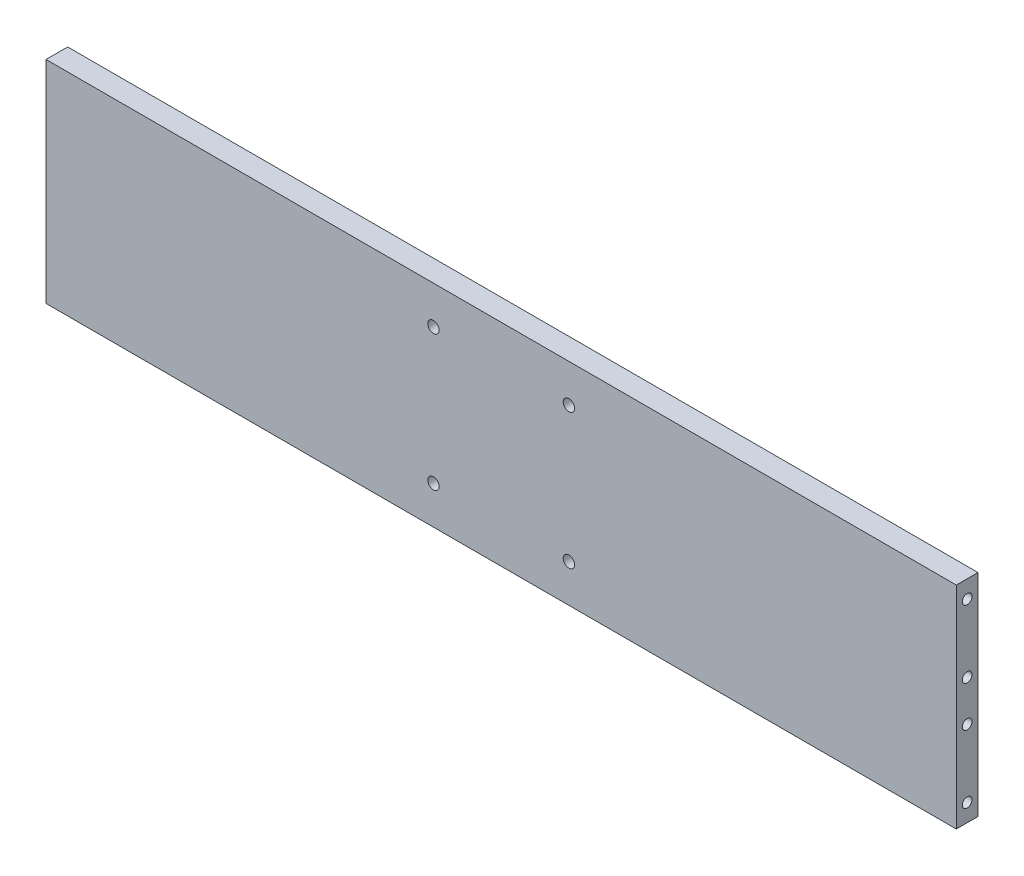
from build123d import *

# Parameters (mm, degrees)
SKETCH1_W           = 336
SKETCH1_H           = 78
SKETCH1_R           = 2.1
BOSS_EXTRUDE1_DEPTH = 8
CUT_EXTRUDE1_REACH  = 340.35
SKETCH2_R           = 1.8


with BuildPart() as part:
    # Sketch1 → Boss-Extrude1 (new body)
    with BuildSketch(Plane.XY):
        Rectangle(SKETCH1_W, SKETCH1_H)
        with Locations((-25, 25)):
            Circle(SKETCH1_R, mode=Mode.SUBTRACT)
        with Locations((25, 25)):
            Circle(SKETCH1_R, mode=Mode.SUBTRACT)
        with Locations((25, -25)):
            Circle(SKETCH1_R, mode=Mode.SUBTRACT)
        with Locations((-25, -25)):
            Circle(SKETCH1_R, mode=Mode.SUBTRACT)
    extrude(amount=BOSS_EXTRUDE1_DEPTH)

    # Sketch2 → Cut-Extrude1 (cut, up to next)
    with BuildSketch(Plane(origin=(168, 0, 0), x_dir=(0, 0, -1), z_dir=(1, 0, 0)), mode=Mode.PRIVATE) as cut_extrude1_sk1:
        with Locations((-4, 32.5)):
            Circle(SKETCH2_R)
    cut_extrude1_tool1 = extrude(cut_extrude1_sk1.sketch, amount=-CUT_EXTRUDE1_REACH, mode=Mode.PRIVATE) & part.part
    # Sketch2 → Cut-Extrude1 (cut, up to next)
    with BuildSketch(Plane(origin=(168, 0, 0), x_dir=(0, 0, -1), z_dir=(1, 0, 0)), mode=Mode.PRIVATE) as cut_extrude1_sk2:
        with Locations((-4, 7.5)):
            Circle(SKETCH2_R)
    cut_extrude1_tool2 = extrude(cut_extrude1_sk2.sketch, amount=-CUT_EXTRUDE1_REACH, mode=Mode.PRIVATE) & part.part
    # Sketch2 → Cut-Extrude1 (cut, up to next)
    with BuildSketch(Plane(origin=(168, 0, 0), x_dir=(0, 0, -1), z_dir=(1, 0, 0)), mode=Mode.PRIVATE) as cut_extrude1_sk3:
        with Locations((-4, -7.5)):
            Circle(SKETCH2_R)
    cut_extrude1_tool3 = extrude(cut_extrude1_sk3.sketch, amount=-CUT_EXTRUDE1_REACH, mode=Mode.PRIVATE) & part.part
    # Sketch2 → Cut-Extrude1 (cut, up to next)
    with BuildSketch(Plane(origin=(168, 0, 0), x_dir=(0, 0, -1), z_dir=(1, 0, 0)), mode=Mode.PRIVATE) as cut_extrude1_sk4:
        with Locations((-4, -32.5)):
            Circle(SKETCH2_R)
    cut_extrude1_tool4 = extrude(cut_extrude1_sk4.sketch, amount=-CUT_EXTRUDE1_REACH, mode=Mode.PRIVATE) & part.part
    add(cut_extrude1_tool1.solids().sort_by_distance((168, 32.5, 4))[0], mode=Mode.SUBTRACT)
    add(cut_extrude1_tool2.solids().sort_by_distance((168, 7.5, 4))[0], mode=Mode.SUBTRACT)
    add(cut_extrude1_tool3.solids().sort_by_distance((168, -7.5, 4))[0], mode=Mode.SUBTRACT)
    add(cut_extrude1_tool4.solids().sort_by_distance((168, -32.5, 4))[0], mode=Mode.SUBTRACT)


solid = part.part
